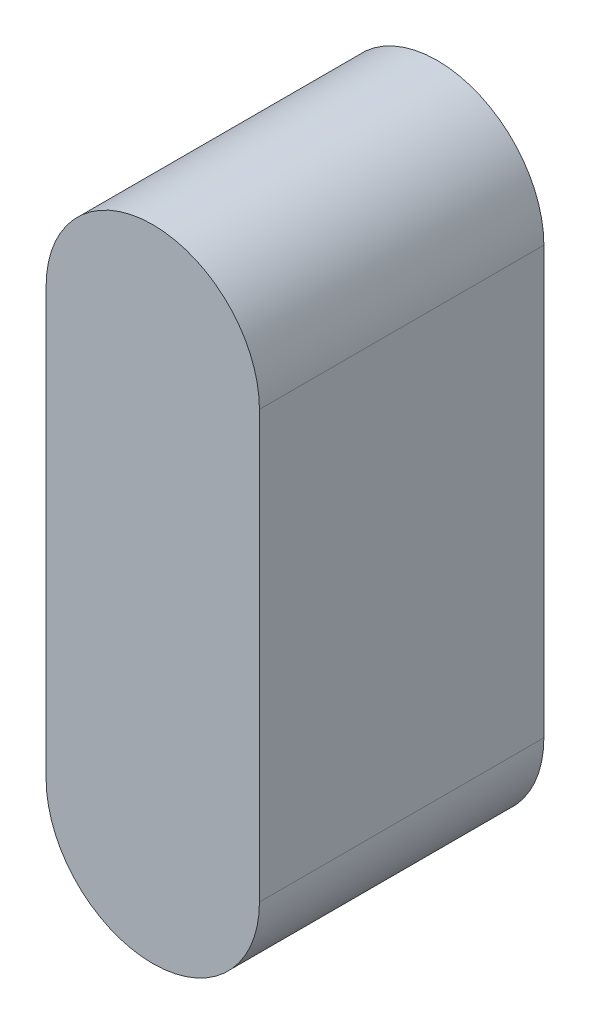
from build123d import *

# Parameters (mm, degrees)
BOSS_EXTRUDE1_DEPTH = 8


with BuildPart() as part:
    # Sketch1 → Boss-Extrude1 (new body)
    with BuildSketch(Plane.XY):
        with BuildLine():
            Line((-3, 6), (-3, -6))
            ThreePointArc((-3, -6), (0, -9), (3, -6))
            Line((3, -6), (3, 6))
            ThreePointArc((3, 6), (0, 9), (-3, 6))
        make_face()
    extrude(amount=BOSS_EXTRUDE1_DEPTH)


solid = part.part
